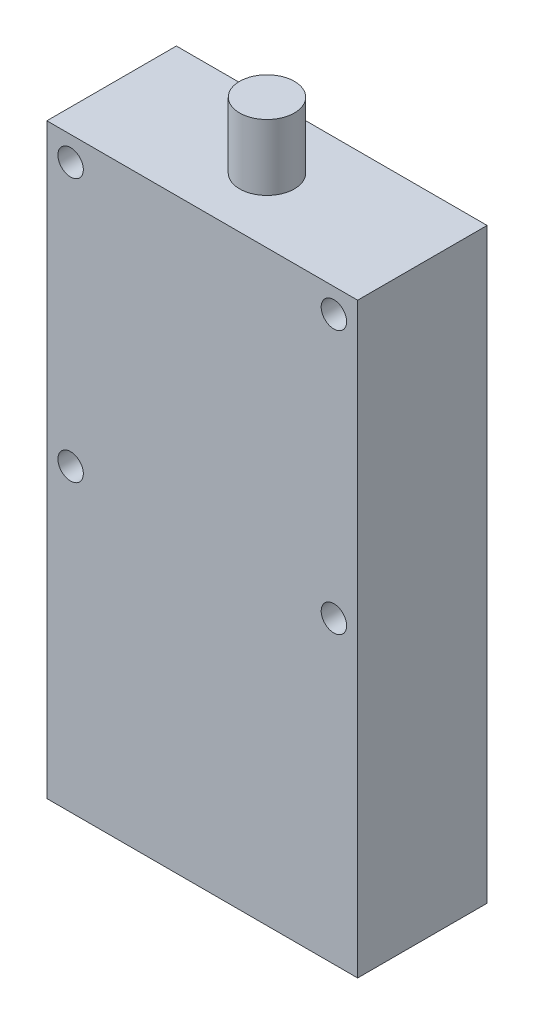
from build123d import *

# Parameters (mm, degrees)
SKETCH1_W                          = 36
SKETCH1_H                          = 68
BOSS_EXTRUDE1_DEPTH                = 15
F_1_16_0_116_DOWEL_HOLE1_OUTLINE_R = 1.4732
F_1_16_0_116_DOWEL_HOLE1_DEPTH     = 15
SKETCH5_R                          = 3.175
BOSS_EXTRUDE2_DEPTH                = 7.62


# Read off the part's stored shape, not the designer's step: 1/16 (0.116) Dowel Hole1
with BuildPart() as part:
    # Sketch1 → Boss-Extrude1 (new body)
    with BuildSketch(Plane.XY):
        Rectangle(SKETCH1_W, SKETCH1_H)
    extrude(amount=BOSS_EXTRUDE1_DEPTH)

    # 1/16 (0.116) Dowel Hole1 outline → 1/16 (0.116) Dowel Hole1 (cut)
    with BuildSketch(Plane.XY):
        with Locations((15.25, 31.206)):
            Circle(F_1_16_0_116_DOWEL_HOLE1_OUTLINE_R)
        with Locations((-15.25, 0.706)):
            Circle(F_1_16_0_116_DOWEL_HOLE1_OUTLINE_R)
        with Locations((15.25, 0.706)):
            Circle(F_1_16_0_116_DOWEL_HOLE1_OUTLINE_R)
        with Locations((-15.25, 31.206)):
            Circle(F_1_16_0_116_DOWEL_HOLE1_OUTLINE_R)
    extrude(amount=F_1_16_0_116_DOWEL_HOLE1_DEPTH, mode=Mode.SUBTRACT)

    # Sketch5 → Boss-Extrude2 (add)
    with BuildSketch(Plane(origin=(0, 34, 0), x_dir=(1, 0, 0), z_dir=(0, 1, 0))):
        with Locations((0, -7.5)):
            Circle(SKETCH5_R)
    extrude(amount=BOSS_EXTRUDE2_DEPTH)


solid = part.part
